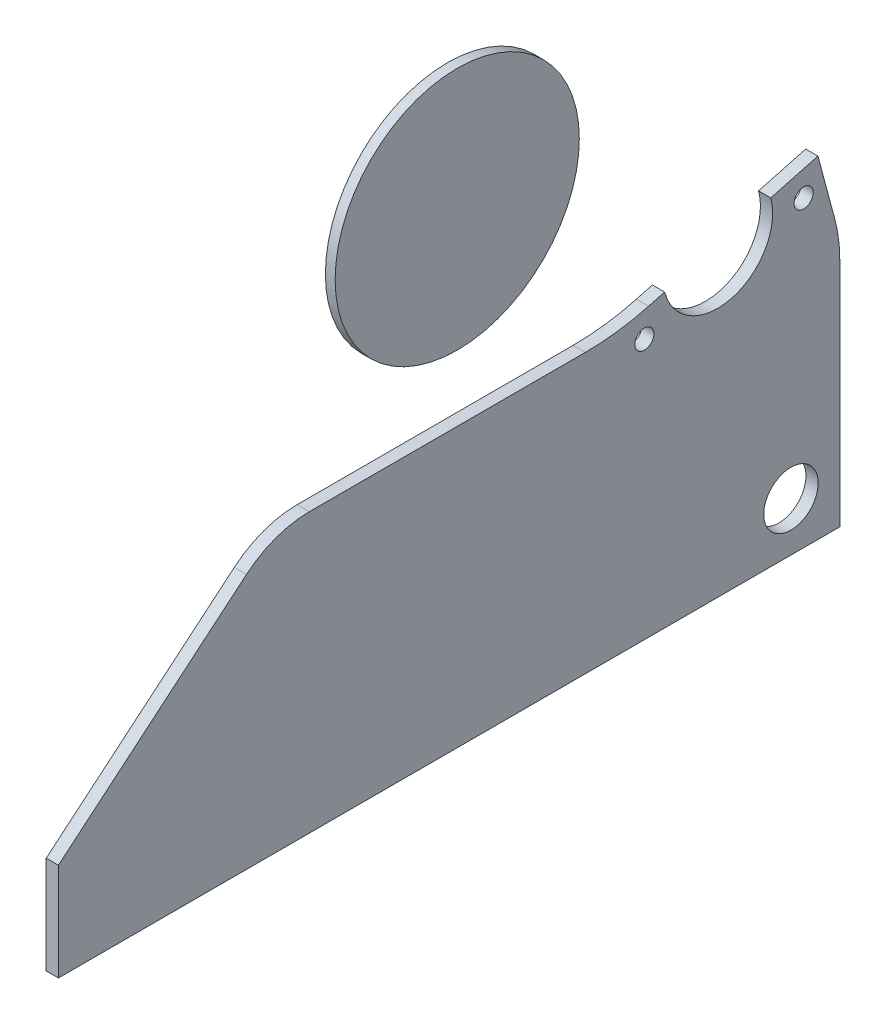
from build123d import *

# Parameters (mm, degrees)
BOSS_EXTRUDE1_DEPTH    = 3.175
F_10_CLEARANCE_HOLE1_D = 4.9784
SKETCH9_R              = 7.0739
CUT_EXTRUDE1_DEPTH     = 213.170750742
FILLET1_R              = 38.1
FILLET2_R              = 63.5
SKETCH10_R             = 31.75
BOSS_EXTRUDE2_DEPTH    = 2.54


with BuildPart() as part:
    # Sketch1 → Boss-Extrude1 (new body)
    with BuildSketch(Plane(origin=(0, 0, 0), x_dir=(0, 0, -1), z_dir=(1, 0, 0))):
        with BuildLine():
            Line((0, -25.4), (0, 39.754079808))
            Line((0, 39.754079808), (-5.682076763, 60.95987898))
            Line((-5.682076763, 60.95987898), (-17.949334757, 57.672877107))
            ThreePointArc((-17.949334757, 57.672877107), (-28.052122893, 40.174334757), (-45.550665243, 50.277122893))
            Line((-45.550665243, 50.277122893), (-57.817923237, 46.99012102))
            Line((-57.817923237, 46.99012102), (-137.954510507, 46.99012102))
            ThreePointArc((-137.954510507, 46.99012102), (-146.641822148, 45.458313588), (-154.281315793, 41.047649876))
            Line((-154.281315793, 41.047649876), (-203.2, 0))
            Line((-203.2, 0), (-203.2, -25.4))
            Line((-203.2, -25.4), (0, -25.4))
        make_face()
    extrude(amount=BOSS_EXTRUDE1_DEPTH)

    # #10 Clearance Hole1 (through all)
    with Locations(Plane(origin=(3.175, 0, 0), x_dir=(0, 0, -1), z_dir=(1, 0, 0))):
        with Locations((-50.807496928, 42.294555343), (-9.405501199, 53.388186663)):
            Hole(F_10_CLEARANCE_HOLE1_D / 2)

    # Sketch9 → Cut-Extrude1 (cut, through all)
    with BuildSketch(Plane(origin=(3.175, 0, 0), x_dir=(0, 0, -1), z_dir=(1, 0, 0))):
        with Locations((-12.7, -12.7)):
            Circle(SKETCH9_R)
    extrude(amount=-CUT_EXTRUDE1_DEPTH, mode=Mode.SUBTRACT)

    # Fillet1
    fillet1_edges = [part.edges().sort_by_distance(p)[0] for p in [
        (1.5875, 39.754079808, 0),
    ]]
    fillet(fillet1_edges, radius=FILLET1_R)

    # Fillet2
    fillet2_edges = [part.edges().sort_by_distance(p)[0] for p in [
        (1.5875, 46.99012102, 57.817923237),
    ]]
    fillet(fillet2_edges, radius=FILLET2_R)


with BuildPart() as body_2:
    # Sketch10 → Boss-Extrude2 (new body)
    with BuildSketch(Plane(origin=(0, 0, 0), x_dir=(0, 0, -1), z_dir=(1, 0, 0))):
        with Locations((-98.850793794, 95.25)):
            Circle(SKETCH10_R)
    extrude(amount=BOSS_EXTRUDE2_DEPTH)


solid = Compound([part.part, body_2.part])
